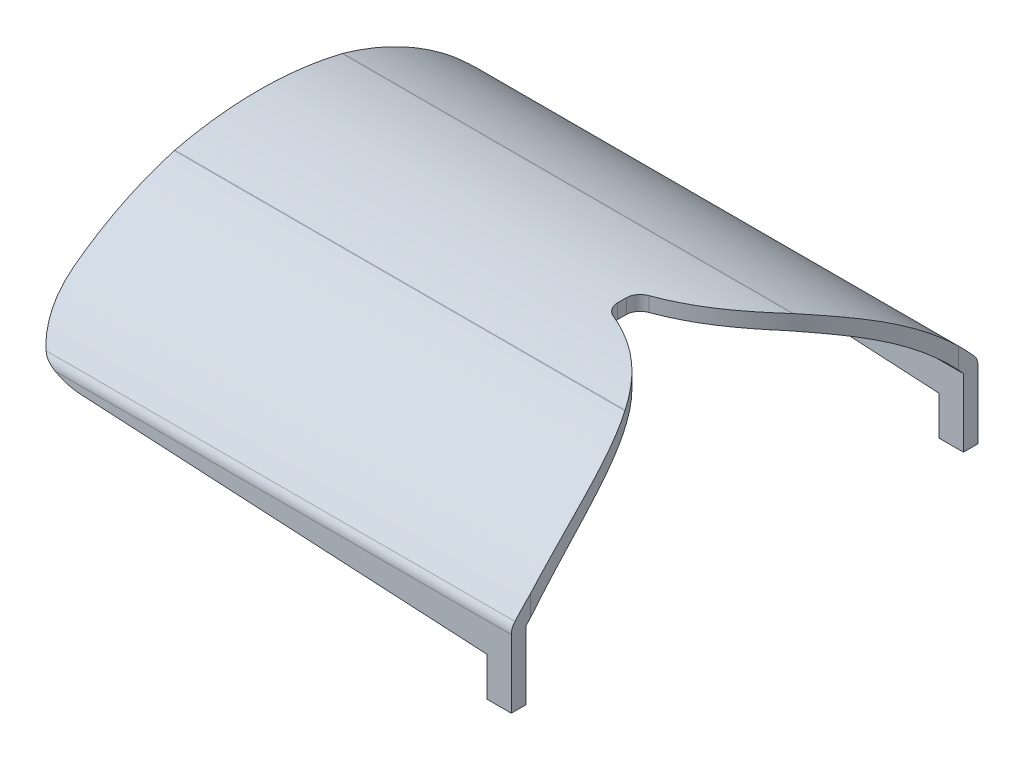
from build123d import *

# Parameters (mm, degrees)
EXTRUDE_THIN1_DEPTH = 100
CUT_EXTRUDE2_DEPTH  = 33.5
FILLET1_R           = 3
SKETCH6_W           = 108.670856817
SKETCH6_H           = 17.879774232
CUT_EXTRUDE3_DEPTH  = 166
BOSS_EXTRUDE1_DEPTH = 10.5
CUT_EXTRUDE4_DEPTH  = 27
CUT_EXTRUDE7_DEPTH  = 5
FILLET5_R           = 12


with BuildPart() as part:
    # Sketch1 → Extrude-Thin1 (new body)
    with BuildSketch(Plane(origin=(0, 0, 0), x_dir=(0, 0, -1), z_dir=(1, 0, 0))):
        with BuildLine():
            Line((45, -32), (45, -18))
            ThreePointArc((45, -18), (32.040658091, -6.957616726), (16.501342128, 0))
            ThreePointArc((16.501342128, 0), (0, 1.972757604), (-16.501342128, 0))
            ThreePointArc((-16.501342128, 0), (-32.040658091, -6.957616726), (-45, -18))
            Line((-45, -18), (-45, -32))
            Line((-45, -32), (-48, -32))
            Line((-48, -32), (-48, -16.88185814))
            ThreePointArc((-48, -16.88185814), (-34.099982932, -4.712774746), (-17.26768466, 2.901081048))
            ThreePointArc((-17.26768466, 2.901081048), (0, 4.972757604), (17.26768466, 2.901081048))
            ThreePointArc((17.26768466, 2.901081048), (34.099982932, -4.712774746), (48, -16.88185814))
            Line((48, -16.88185814), (48, -32))
            Line((48, -32), (45, -32))
        make_face()
    extrude(amount=EXTRUDE_THIN1_DEPTH)

    # Sketch5 → Cut-Extrude2 (cut, symmetric)
    with BuildSketch(Plane(origin=(0, 0, 0), x_dir=(1, 0, 0), z_dir=(0, 1, 0))):
        with BuildLine():
            Line((74.78082212, 3), (74.78082212, -3))
            add(Edge.make_bspline(
                [(74.78082212, -3), (97.634090292, -10.562952057), (100, -44)],
                knots=[0, 0, 0, 1, 1, 1], degree=2))
            Line((100, -44), (100, 44))
            add(Edge.make_bspline(
                [(74.78082212, 3), (97.634090292, 10.562952057), (100, 44)],
                knots=[0, 0, 0, 1, 1, 1], degree=2))
        make_face()
    extrude(amount=CUT_EXTRUDE2_DEPTH, both=True, mode=Mode.SUBTRACT)

    # Fillet1
    fillet1_edges = [part.edges().sort_by_distance(p)[0] for p in [
        (50, -16.88185814, -48),
        (50, -16.88185814, 48),
        (74.78082212, 3.409765032, 3),
        (74.78082212, 3.409765032, -3),
        (46.328171757, 2.901081048, -17.26768466),
        (46.328171757, 2.901081048, 17.26768466),
    ]]
    fillet(fillet1_edges, radius=FILLET1_R)

    # Sketch6 → Cut-Extrude3 (cut)
    with BuildSketch(Plane(origin=(0, 0, -48), x_dir=(-1, 0, 0), z_dir=(0, 0, -1))):
        with Locations((-40.664571591, -32.939887116)):
            Rectangle(SKETCH6_W, SKETCH6_H)
    extrude(amount=-CUT_EXTRUDE3_DEPTH, mode=Mode.SUBTRACT)

    # Sketch8 → Boss-Extrude1 (add, symmetric)
    with BuildSketch(Plane.XY):
        Polygon((0, 1.972757604), (-2.848910504, -18), (7.151089496, -18), (15, 1.972757604), align=None)
    extrude(amount=BOSS_EXTRUDE1_DEPTH, both=True)

    # Sketch10 → Cut-Extrude4 (cut)
    with BuildSketch(Plane.XY.offset(10.5)):
        with BuildLine():
            Line((-0.348910504, -18), (3.987157996, -18))
            ThreePointArc((3.987157996, -18), (1.819123746, -14.255159652), (-0.348910504, -18))
        make_face()
    extrude(amount=-CUT_EXTRUDE4_DEPTH, mode=Mode.SUBTRACT)

    # Sketch15 → Cut-Extrude7 (cut)
    with BuildSketch(Plane(origin=(0, 0, -48), x_dir=(-1, 0, 0), z_dir=(0, 0, -1))):
        Polygon((-95, -24), (0, -18.860125055), (0, -26.57204687), align=None)
    cut_extrude7 = extrude(amount=-CUT_EXTRUDE7_DEPTH, mode=Mode.SUBTRACT)

    # Mirror2: Cut-Extrude7 across plane
    add(cut_extrude7.mirror(Plane.XY), mode=Mode.SUBTRACT)

    # Fillet5
    # the kernel refuses this fillet: 12 mm, written as the material it takes off along each edge
    with BuildSketch(Plane(origin=(0, -18.860125055, 76.420758066), x_dir=(0, 1, 0), z_dir=(0, 0, -1))) as fillet5_piece_1:
        with BuildLine():
            CenterArc((FILLET5_R * 0.947358602211, FILLET5_R), FILLET5_R, 183.096908366, 86.903091634)
            Line((-FILLET5_R * 0.0511809847104, FILLET5_R * 0.945975067318), (0, 0))
            Line((0, 0), (FILLET5_R * 0.947358602211, 0))
        make_face()
    extrude(amount=59.841516133, mode=Mode.SUBTRACT)
    with BuildSketch(Plane(origin=(0, -18.860125055, -76.420758066), x_dir=(0, 1, 0), z_dir=(0, 0, 1))) as fillet5_piece_2:
        with BuildLine():
            CenterArc((FILLET5_R * 0.947358602211, -FILLET5_R), FILLET5_R, 90, 86.903091634)
            Line((-FILLET5_R * 0.0511809847104, -FILLET5_R * 0.945975067318), (0, 0))
            Line((0, 0), (FILLET5_R * 0.947358602211, 0))
        make_face()
    extrude(amount=59.841516133, mode=Mode.SUBTRACT)


solid = part.part
